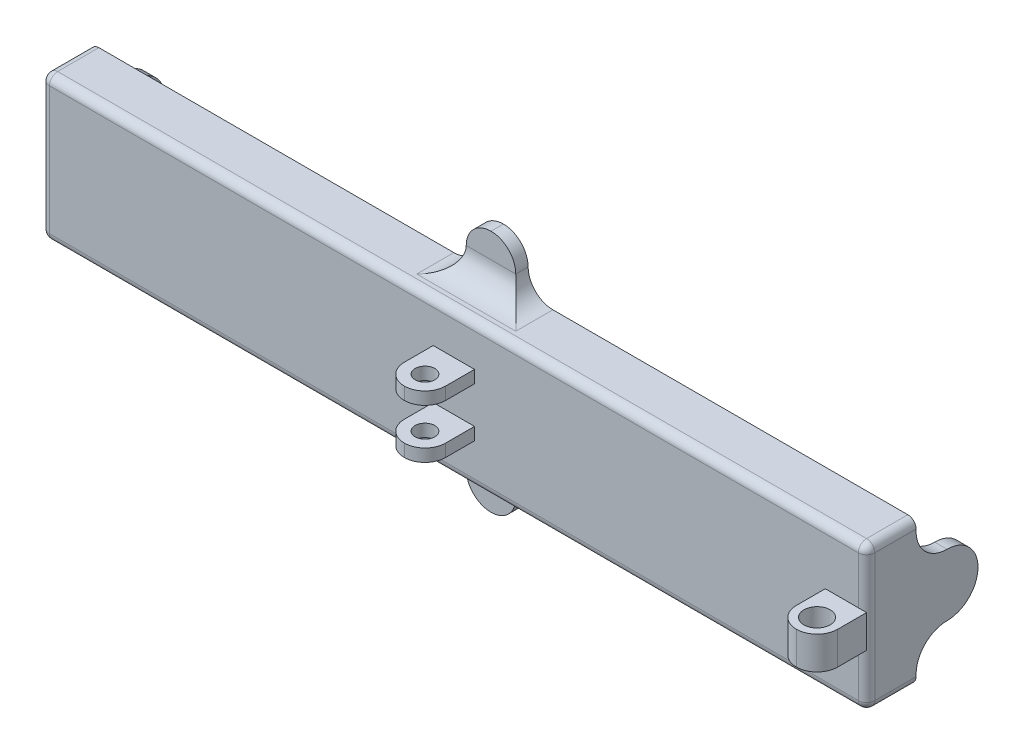
from build123d import *

# Parameters (mm, degrees)
BOSS_EXTRUDE1_DEPTH = 12
SKETCH7_W           = 10
SKETCH7_H           = 7.9375
BOSS_EXTRUDE2_DEPTH = 12
SKETCH9_R           = 3.175
CUT_EXTRUDE3_DEPTH  = 205.196369279
SKETCH15_W          = 10
SKETCH15_H          = 3.03125
BOSS_EXTRUDE4_DEPTH = 12
SKETCH16_R          = 2.38125
CUT_EXTRUDE7_DEPTH  = 205.8047851
FILLET1_R           = 5
FILLET2_R           = 5
SKETCH17_R          = 20.5
CUT_EXTRUDE8_DEPTH  = 194
SKETCH18_W          = 3
SKETCH18_H          = 15
BOSS_EXTRUDE5_DEPTH = 15
FILLET3_DEPTH       = 200
FILLET3_2_DEPTH     = 3
FILLET3_START       = 197
FILLET3_3_DEPTH     = 3
SKETCH19_W          = 9
SKETCH19_H          = 12
CUT_EXTRUDE9_DEPTH  = 12
FILLET4_R           = 6
FILLET5_R           = 2


with BuildPart() as part:
    # Sketch2 → Boss-Extrude1 (new body)
    with BuildSketch(Plane.XY):
        Polygon((0, 0), (94, 0), (94, -12), (106, -12), (106, 0), (200, 0), (200, 35), (106, 35), (106, 47), (94, 47), (94, 35), (0, 35), align=None)
    extrude(amount=BOSS_EXTRUDE1_DEPTH)

    # Sketch15 → Boss-Extrude4 (add)
    with BuildSketch(Plane.XY.offset(12)):
        with Locations((100, 23.484375)):
            Rectangle(SKETCH15_W, SKETCH15_H)
        with Locations((100, 11.515625)):
            Rectangle(SKETCH15_W, SKETCH15_H)
    extrude(amount=BOSS_EXTRUDE4_DEPTH)

    # Sketch16 → Cut-Extrude7 (cut, through all)
    with BuildSketch(Plane(origin=(0, 25, 0), x_dir=(1, 0, 0), z_dir=(0, 1, 0))):
        with Locations(Location((100, -19, 0), (0, 0, 270))):
            Circle(SKETCH16_R)
    extrude(amount=-CUT_EXTRUDE7_DEPTH, mode=Mode.SUBTRACT)

    # Fillet2
    fillet2_edges = [part.edges().sort_by_distance(p)[0] for p in [
        (95, 11.515625, 24),
        (105, 11.515625, 24),
        (105, 23.484375, 24),
        (95, 23.484375, 24),
    ]]
    fillet(fillet2_edges, radius=FILLET2_R - 0.0001)  # a hair under: the kernel refuses the full size

    # Sketch17 → Cut-Extrude8 (cut)
    with BuildSketch(Plane(origin=(197, 0, 0), x_dir=(0, 0, -1), z_dir=(1, 0, 0))):
        with Locations((13.5, 17.5)):
            Circle(SKETCH17_R)
    extrude(amount=-CUT_EXTRUDE8_DEPTH, mode=Mode.SUBTRACT)

    # Sketch18 → Boss-Extrude5 (add)
    with BuildSketch(Plane(origin=(0, 0, 0), x_dir=(-1, 0, 0), z_dir=(0, 0, -1))):
        with Locations((-1.5, 17.5)):
            Rectangle(SKETCH18_W, SKETCH18_H)
        with Locations((-198.5, 17.5)):
            Rectangle(SKETCH18_W, SKETCH18_H)
    extrude(amount=BOSS_EXTRUDE5_DEPTH)

    # Fillet3: read off the stored shape, not the designer's step
    # Fillet3 outline → Fillet3 (cut)
    with BuildSketch(Plane.YZ):
        with BuildLine():
            Line((10, -15), (17.5, -15))
            ThreePointArc((17.5, -15), (12.196699141, -12.803300859), (10, -7.5))
            Line((10, -7.5), (10, -15))
        make_face()
        with BuildLine():
            Line((25, -15), (25, -7.5))
            ThreePointArc((25, -7.5), (22.803300859, -12.803300859), (17.5, -15))
            Line((17.5, -15), (25, -15))
        make_face()
    extrude(amount=FILLET3_DEPTH, mode=Mode.SUBTRACT)

    # Fillet3 2 outline → Fillet3 2 (add)
    with BuildSketch(Plane.YZ):
        with BuildLine():
            ThreePointArc((2.5, 0), (7.803300859, -2.196699141), (10, -7.5))
            Line((10, -7.5), (10, 0))
            Line((10, 0), (2.5, 0))
        make_face()
        with BuildLine():
            ThreePointArc((25, -7.5), (27.196699141, -2.196699141), (32.5, 0))
            Line((32.5, 0), (25, 0))
            Line((25, 0), (25, -7.5))
        make_face()
    extrude(amount=FILLET3_2_DEPTH)

    # Fillet3 3 outline → Fillet3 3 (add)
    with BuildSketch(Plane.YZ.offset(FILLET3_START)):
        with BuildLine():
            ThreePointArc((2.5, 0), (7.803300859, -2.196699141), (10, -7.5))
            Line((10, -7.5), (10, 0))
            Line((10, 0), (2.5, 0))
        make_face()
        with BuildLine():
            ThreePointArc((25, -7.5), (27.196699141, -2.196699141), (32.5, 0))
            Line((32.5, 0), (25, 0))
            Line((25, 0), (25, -7.5))
        make_face()
    extrude(amount=FILLET3_3_DEPTH)

    # Sketch19 → Cut-Extrude9 (cut)
    with BuildSketch(Plane.ZY.offset(-94)):
        with Locations((7.5, -6)):
            Rectangle(SKETCH19_W, SKETCH19_H)
        with Locations((7.5, 41)):
            Rectangle(SKETCH19_W, SKETCH19_H)
    extrude(amount=-CUT_EXTRUDE9_DEPTH, mode=Mode.SUBTRACT)

    # Fillet4
    fillet4_edges = [part.edges().sort_by_distance(p)[0] for p in [
        (94, 35, 1.5),
        (100, 35, 3),
        (106, 35, 1.5),
        (106, 47, 1.5),
        (94, 47, 1.5),
        (94, 0, 1.5),
        (100, 0, 3),
        (106, 0, 1.5),
        (94, -12, 1.5),
        (106, -12, 1.5),
    ]]
    fillet(fillet4_edges, radius=FILLET4_R - 0.0001)  # a hair under: the kernel refuses the full size

    # Fillet5
    fillet5_edges = [part.edges().sort_by_distance(p)[0] for p in [
        (0, 35, 6),
        (200, 35, 6),
        (200, 0, 6),
        (0, 0, 6),
        (200, 17.5, 12),
        (100, 35, 12),
        (0, 17.5, 12),
        (100, 0, 12),
    ]]
    fillet(fillet5_edges, radius=FILLET5_R)


with BuildPart() as body_2:
    # Sketch7 → Boss-Extrude2 (new body)
    with BuildSketch(Plane.XY.offset(12)):
        with Locations((195, 17.5)):
            Rectangle(SKETCH7_W, SKETCH7_H)
    extrude(amount=BOSS_EXTRUDE2_DEPTH)

    # Sketch9 → Cut-Extrude3 (cut, through all)
    with BuildSketch(Plane(origin=(0, 21.46875, 0), x_dir=(1, 0, 0), z_dir=(0, 1, 0))):
        with Locations(Location((195, -19, 0), (0, 0, 270))):
            Circle(SKETCH9_R)
    extrude(amount=-CUT_EXTRUDE3_DEPTH, mode=Mode.SUBTRACT)

    # Fillet1
    fillet1_edges = [body_2.edges().sort_by_distance(p)[0] for p in [
        (190, 17.5, 24),
        (200, 17.5, 24),
    ]]
    fillet(fillet1_edges, radius=FILLET1_R - 0.0001)  # a hair under: the kernel refuses the full size


solid = Compound([part.part, body_2.part])
